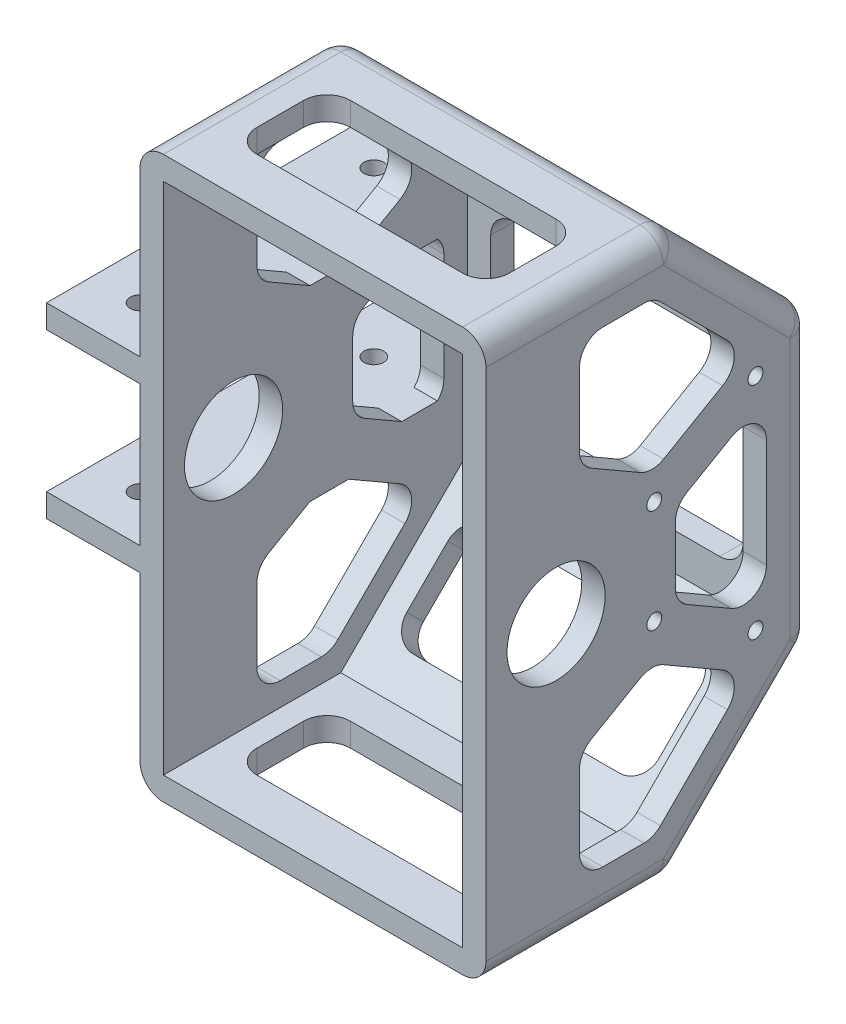
from build123d import *

# Parameters (mm, degrees)
SKETCH_1_W           = 74
SKETCH_1_H           = 120
EXTRUDE_1_DEPTH      = 70
CHAMFER_2_SIZE       = 30
SHELL_1_T            = -5
SKETCH_2_R           = 10.5
CUT_EXTRUDE_1_DEPTH  = 119.220133649
SKETCH_3_W           = 54
SKETCH_3_H           = 22.426406871
CUT_EXTRUDE_2_DEPTH  = 70
SKETCH_4_W           = 54
SKETCH_4_H           = 22.426406871
CUT_EXTRUDE_3_DEPTH  = 70
SKETCH_5_W           = 54
SKETCH_5_H           = 40
CUT_EXTRUDE_4_DEPTH  = 70
SKETCH_7_W           = 54
SKETCH_7_H           = 20
CUT_EXTRUDE_5_DEPTH  = 144.767172887
FILLET_1_R           = 5
EXTRUDE_3_DEPTH      = 20
EXTRUDE_3_DEPTH_BACK = 5
SKETCH_10_W          = 70
SKETCH_10_H          = 5
SKETCH_12_R          = 2.1
CUT_EXTRUDE_7_DEPTH  = 121.619235614
SKETCH_13_R          = 1.6
CUT_EXTRUDE_8_DEPTH  = 10


with BuildPart() as part:
    # ｽｹｯﾁ1 → ﾎﾞｽ - 押し出し1 (new body)
    with BuildSketch(Plane.XY):
        Rectangle(SKETCH_1_W, SKETCH_1_H)
    extrude(amount=EXTRUDE_1_DEPTH)

    # 面取り2
    chamfer_2_edges = [part.edges().sort_by_distance(p)[0] for p in [
        (0, 60, 0),
        (0, -60, 0),
    ]]
    chamfer(chamfer_2_edges, length=CHAMFER_2_SIZE)

    # ｼｪﾙ1
    shell_1_openings = [part.faces().sort_by_distance(p)[0] for p in [
        (0, 0, 70),
    ]]
    offset(amount=SHELL_1_T, openings=shell_1_openings, kind=Kind.INTERSECTION)

    # ｽｹｯﾁ2 → ｶｯﾄ - 押し出し1 (cut, through all)
    with BuildSketch(Plane.ZY.offset(37)):
        Polygon((34.142135624, -50), (50, -50), (50, -26.558112383), (34.5, -17.60918321), (13.738168081, -29.596032457), align=None)
        with Locations((55, 0)):
            Circle(SKETCH_2_R)
        Polygon((34.142135624, 50), (13.738168081, 29.596032457), (34.5, 17.60918321), (50, 26.558112383), (50, 50), align=None)
        Polygon((10, 20.207259422), (10, -20.207259422), (29.5, -8.948929172), (29.5, 8.948929172), align=None)
    extrude(amount=-CUT_EXTRUDE_1_DEPTH, mode=Mode.SUBTRACT)

    # ｽｹｯﾁ3 → ｶｯﾄ - 押し出し2 (cut)
    with BuildSketch(Plane(origin=(0, -15, -15), x_dir=(1, 0, 0), z_dir=(0, -0.7071067811865464, -0.7071067811865487))):
        with Locations((0, 42.426406872)):
            Rectangle(SKETCH_3_W, SKETCH_3_H)
    extrude(amount=-CUT_EXTRUDE_2_DEPTH, mode=Mode.SUBTRACT)

    # ｽｹｯﾁ4 → ｶｯﾄ - 押し出し3 (cut)
    with BuildSketch(Plane(origin=(0, 15, -15), x_dir=(1, 0, 0), z_dir=(0, 0.7071067811865464, -0.7071067811865487))):
        with Locations((0, -42.426406872)):
            Rectangle(SKETCH_4_W, SKETCH_4_H)
    extrude(amount=-CUT_EXTRUDE_3_DEPTH, mode=Mode.SUBTRACT)

    # ｽｹｯﾁ5 → ｶｯﾄ - 押し出し4 (cut)
    with BuildSketch(Plane(origin=(0, 0, 0), x_dir=(-1, 0, 0), z_dir=(0, 0, -1))):
        Rectangle(SKETCH_5_W, SKETCH_5_H)
    extrude(amount=-CUT_EXTRUDE_4_DEPTH, mode=Mode.SUBTRACT)

    # ｽｹｯﾁ7 → ｶｯﾄ - 押し出し5 (cut, through all)
    with BuildSketch(Plane(origin=(0, 60, 0), x_dir=(1, 0, 0), z_dir=(0, 1, 0))):
        with Locations((0, -50)):
            Rectangle(SKETCH_7_W, SKETCH_7_H)
    extrude(amount=-CUT_EXTRUDE_5_DEPTH, mode=Mode.SUBTRACT)

    # ﾌｨﾚｯﾄ1
    fillet_1_edges = [part.edges().sort_by_distance(p)[0] for p in [
        (27, 51.161165235, 24.696699141),
        (-27, 51.161165235, 24.696699141),
        (-27, 35.303300859, 8.838834765),
        (27, 35.303300859, 8.838834765),
        (-27, 20, 2.5),
        (-27, -20, 2.5),
        (27, 20, 2.5),
        (27, -20, 2.5),
        (-27, -35.303300859, 8.838834765),
        (-27, -51.161165235, 24.696699141),
        (27, -51.161165235, 24.696699141),
        (27, -35.303300859, 8.838834765),
        (34.5, -50, 34.142135624),
        (34.5, -29.596032457, 13.738168081),
        (34.5, -17.60918321, 34.5),
        (34.5, -26.558112383, 50),
        (34.5, -50, 50),
        (34.5, 26.558112383, 50),
        (34.5, 17.60918321, 34.5),
        (34.5, 29.596032457, 13.738168081),
        (34.5, 50, 34.142135624),
        (34.5, 50, 50),
        (34.5, -20.207259422, 10),
        (34.5, -8.948929172, 29.5),
        (34.5, 8.948929172, 29.5),
        (34.5, 20.207259422, 10),
        (-34.5, 29.596032457, 13.738168081),
        (-34.5, 50, 34.142135624),
        (-34.5, 50, 50),
        (-34.5, 26.558112383, 50),
        (-34.5, 17.60918321, 34.5),
        (-34.5, 20.207259422, 10),
        (-34.5, 8.948929172, 29.5),
        (-34.5, -20.207259422, 10),
        (-34.5, -8.948929172, 29.5),
        (-34.5, -29.596032457, 13.738168081),
        (-34.5, -17.60918321, 34.5),
        (-34.5, -26.558112383, 50),
        (-34.5, -50, 50),
        (-34.5, -50, 34.142135624),
        (-27, -57.5, 60),
        (-27, -57.5, 40),
        (27, -57.5, 40),
        (27, -57.5, 60),
        (27, 57.5, 60),
        (27, 57.5, 40),
        (-27, 57.5, 40),
        (-27, 57.5, 60),
        (37, -45, 15),
        (37, -60, 50),
        (-37, -60, 50),
        (-37, -45, 15),
        (0, -30, 0),
        (-37, 0, 0),
        (-37, 45, 15),
        (0, 60, 30),
        (-37, 60, 50),
        (37, 60, 50),
        (0, 30, 0),
        (37, 45, 15),
        (37, 0, 0),
        (0, -60, 30),
    ]]
    fillet(fillet_1_edges, radius=FILLET_1_R)

    # ｽｹｯﾁ10 → ﾎﾞｽ - 押し出し3 (add, two sides: drawn at the far end of the back side and taken through both)
    with BuildSketch(Plane.ZY.offset(37).offset(-EXTRUDE_3_DEPTH_BACK)):
        with Locations((35, 17.5)):
            Rectangle(SKETCH_10_W, SKETCH_10_H)
        with Locations((35, -17.5)):
            Rectangle(SKETCH_10_W, SKETCH_10_H)
    extrude(amount=EXTRUDE_3_DEPTH + EXTRUDE_3_DEPTH_BACK)

    # ｽｹｯﾁ12 → ｶｯﾄ - 押し出し7 (cut, through all)
    with BuildSketch(Plane.XZ.offset(20)):
        with Locations((-47, 60)):
            Circle(SKETCH_12_R)
        with Locations((-47, 10)):
            Circle(SKETCH_12_R)
    extrude(amount=-CUT_EXTRUDE_7_DEPTH, mode=Mode.SUBTRACT)

    # ｽｹｯﾁ13 → ｶｯﾄ - 押し出し8 (cut)
    with BuildSketch(Plane(origin=(37, 0, 0), x_dir=(0, 0, -1), z_dir=(1, 0, 0))):
        with Locations((-12.349364905, 24.624355653)):
            Circle(SKETCH_13_R)
        with Locations((-34, 12.124355653)):
            Circle(SKETCH_13_R)
        with Locations((-34, -10.011106999)):
            Circle(SKETCH_13_R)
        with Locations((-12.349364905, -22.511106999)):
            Circle(SKETCH_13_R)
    extrude(amount=-CUT_EXTRUDE_8_DEPTH, mode=Mode.SUBTRACT)


solid = part.part
